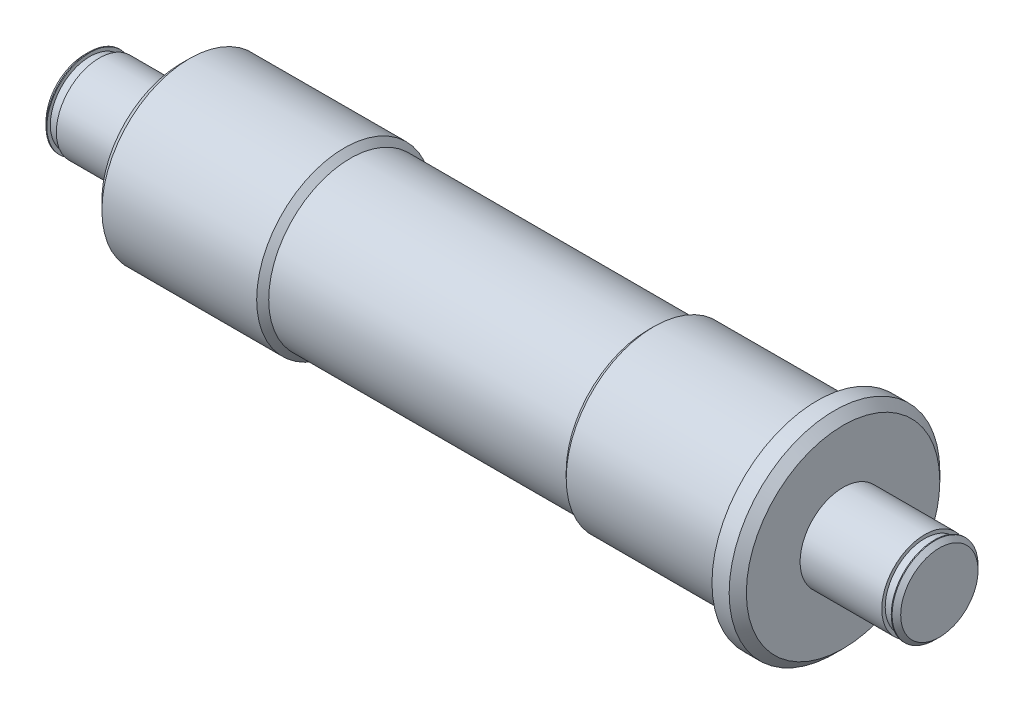
from build123d import *

# Parameters (mm, degrees)
SFAZOWANIE1_SIZE = 1
SFAZOWANIE2_SIZE = 0.5


with BuildPart() as part:
    # Szkic1 → Obrót1 (revolve)
    with BuildSketch(Plane.XY, mode=Mode.PRIVATE) as obr_t1_sk:
        Polygon((0, 0), (0, 5), (0.6, 5), (0.6, 4.6), (1.7, 4.6), (1.7, 5), (11.2, 5), (11.2, 10.2), (31.2, 10.2), (31.2, 9.5), (65.2, 9.5), (65.2, 10.2), (85.2, 10.2), (85.2, 12.25), (88.2, 12.25), (88.2, 5), (97.7, 5), (97.7, 4.6), (98.8, 4.6), (98.8, 5), (99.4, 5), (99.4, 0), align=None)
    revolve(obr_t1_sk.sketch.rotate(Axis((-10.674656103, 0, 0), (1, 0, 0)), 90), axis=Axis((-10.674656103, 0, 0), (1, 0, 0)))

    # Sfazowanie1
    # the kernel refuses this chamfer: 1 mm, written as the material it takes off along each edge
    with BuildSketch(Plane(origin=(65.2, 0, 0), x_dir=(0, 0, 1), z_dir=(0, 1, 0))) as sfazowanie1_piece_1_section:
        Polygon((10.2 - SFAZOWANIE1_SIZE, 0), (10.2, SFAZOWANIE1_SIZE), (10.2, 0), align=None)
    sfazowanie1_piece_1 = revolve(axis=Axis((65.2, 0, 0), (1, 0, 0)), mode=Mode.PRIVATE)
    sfazowanie1_piece_1 = sfazowanie1_piece_1 - Plane(origin=(65.841981052, 0, 0), x_dir=(0, 0, 1), z_dir=(1, 0, 0)) * Cylinder(9.5, 41, mode=Mode.PRIVATE)
    add(sfazowanie1_piece_1, mode=Mode.SUBTRACT)
    with BuildSketch(Plane(origin=(31.2, 0, 0), x_dir=(0, 0, 1), z_dir=(0, 1, 0))) as sfazowanie1_piece_2_section:
        Polygon((10.2, -SFAZOWANIE1_SIZE), (10.2 - SFAZOWANIE1_SIZE, 0), (10.2, 0), align=None)
    sfazowanie1_piece_2 = revolve(axis=Axis((31.2, 0, 0), (1, 0, 0)), mode=Mode.PRIVATE)
    sfazowanie1_piece_2 = sfazowanie1_piece_2 - Plane(origin=(30.558018948, 0, 0), x_dir=(0, 0, 1), z_dir=(1, 0, 0)) * Cylinder(9.5, 41, mode=Mode.PRIVATE)
    add(sfazowanie1_piece_2, mode=Mode.SUBTRACT)
    with BuildSketch(Plane(origin=(88.2, 0, 0), x_dir=(0, 0, 1), z_dir=(0, 1, 0))) as sfazowanie1_piece_3:
        Polygon((12.25, -SFAZOWANIE1_SIZE), (12.25 - SFAZOWANIE1_SIZE, 0), (12.25, 0), align=None)
    revolve(axis=Axis((88.2, 0, 0), (1, 0, 0)), mode=Mode.SUBTRACT)
    with BuildSketch(Plane(origin=(11.2, 0, 0), x_dir=(0, 0, 1), z_dir=(0, 1, 0))) as sfazowanie1_piece_4:
        Polygon((10.2 - SFAZOWANIE1_SIZE, 0), (10.2, SFAZOWANIE1_SIZE), (10.2, 0), align=None)
    revolve(axis=Axis((11.2, 0, 0), (1, 0, 0)), mode=Mode.SUBTRACT)

    # Sfazowanie2
    sfazowanie2_edges = [part.edges().sort_by_distance(p)[0] for p in [
        (99.4, 0, -5),
        (0, 0, -5),
    ]]
    chamfer(sfazowanie2_edges, length=SFAZOWANIE2_SIZE)


solid = part.part
